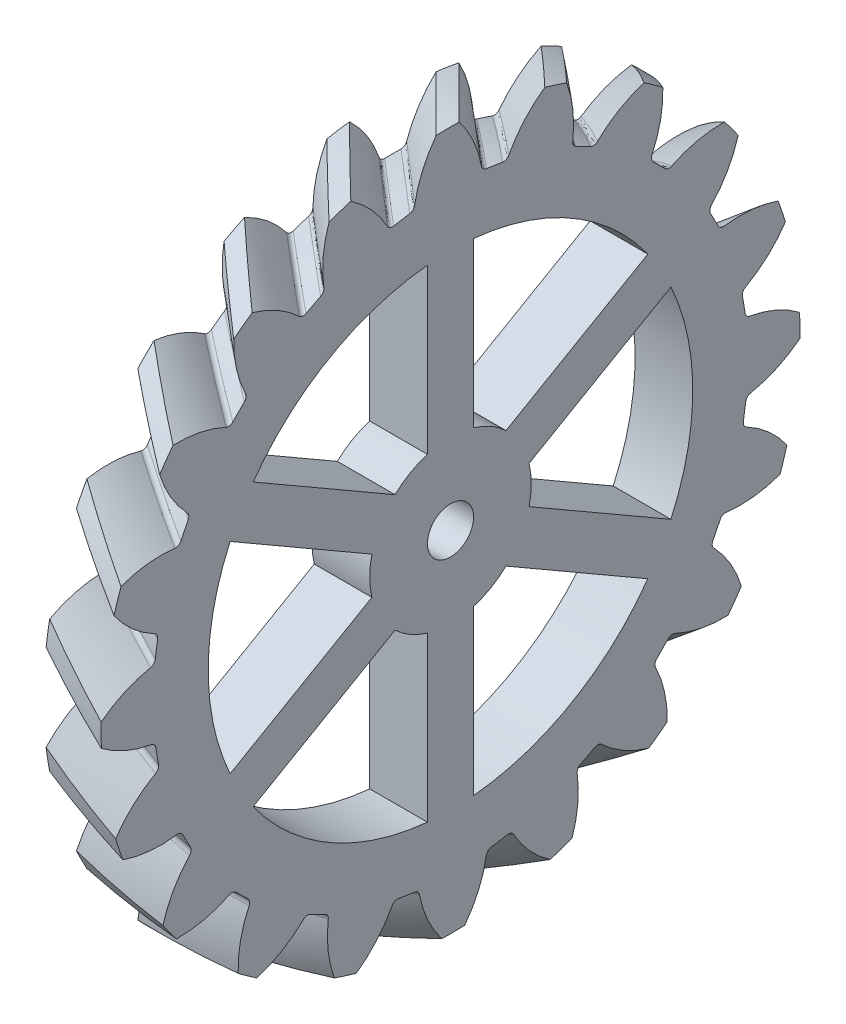
from build123d import *

# Parameters (mm, degrees)
BASPROSKE_W            = 5
BASPROSKE_H            = 30.284271247
TOOTHCUTRH_PITCH       = 190.281688141
TOOTHCUTRH_HEIGHT      = 5
TOOTHCUTRH_RADIUS      = 30.284271247
TOOTHCUTRH_START_ANGLE = -90
TEETHCUTSRH_COUNT      = 20
TEETHCUTSRH_ANGLE      = 342
BORSKE_R               = 2
BORE_DEPTH             = 62.5000025
CUT_EXTRUDE1_DEPTH     = 44.119301747


with BuildPart() as part:
    # BasProSke → Base-Revolve (revolve)
    with BuildSketch(Plane(origin=(0, 0, 0), x_dir=(1, 0, 0), z_dir=(0, 1, 0)), mode=Mode.PRIVATE) as base_revolve_sk:
        with Locations((2.5, 15.142135624)):
            Rectangle(BASPROSKE_W, BASPROSKE_H)
    revolve(base_revolve_sk.sketch.rotate(Axis((-10, 0, 0), (1, 0, 0)), 180), axis=Axis((-10, 0, 0), (1, 0, 0)))

    # ToothCutRH: sweep along a helix
    with BuildLine() as toothcutrh_path:
        add(Helix(TOOTHCUTRH_PITCH, TOOTHCUTRH_HEIGHT, TOOTHCUTRH_RADIUS, center=(0, 0, 0), direction=(1, 0, 0), mode=Mode.PRIVATE).rotate(Axis((0, 0, 0), (1, 0, 0)), TOOTHCUTRH_START_ANGLE))
    # TooCutSkeRH → ToothCutRH (sweep, cut)
    with BuildSketch(Plane(origin=(0, 0, 0), x_dir=(0, 0, -1), z_dir=(1, 0, 0))):
        with BuildLine():
            ThreePointArc((0.709729235, 25.774501512), (0, 25.784271247), (-0.709729235, 25.774501512))
            ThreePointArc((-0.709729235, 25.774501512), (-1.007455511, 25.862538868), (-1.196142332, 26.109092706))
            ThreePointArc((-1.196142332, 26.109092706), (-2.588726145, 28.736284217), (-4.692249269, 30.837858717))
            ThreePointArc((-4.692249269, 30.837858717), (0, 31.192799385), (4.692249269, 30.837858717))
            ThreePointArc((4.692249269, 30.837858717), (2.588726145, 28.736284217), (1.196142332, 26.109092706))
            ThreePointArc((1.196142332, 26.109092706), (1.007455511, 25.862538868), (0.709729235, 25.774501512))
        make_face()
    toothcutrh = sweep(path=toothcutrh_path.line, is_frenet=True, mode=Mode.SUBTRACT)

    # TeethCutsRH: ToothCutRH ×20 about axis
    teethcutsrh_axis = Axis((-10, 0, 0), (1, 0, 0))
    for i in range(1, TEETHCUTSRH_COUNT):
        add(toothcutrh.rotate(teethcutsrh_axis, i * TEETHCUTSRH_ANGLE / (TEETHCUTSRH_COUNT - 1)), mode=Mode.SUBTRACT)

    # BorSke → Bore (cut, symmetric)
    with BuildSketch(Plane(origin=(0, 0, 0), x_dir=(0, 0, -1), z_dir=(1, 0, 0))):
        with Locations(Location((0, 0, 0), (0, 0, 180))):
            Circle(BORSKE_R)
    extrude(amount=BORE_DEPTH, both=True, mode=Mode.SUBTRACT)

    # Sketch3 → Cut-Extrude1 (cut, through all)
    with BuildSketch(Plane(origin=(5, 0, 0), x_dir=(0, 0, -1), z_dir=(1, 0, 0))):
        with BuildLine():
            Line((-4.809475019, 5.086152774), (-17.10386699, 12.184323288))
            ThreePointArc((-17.10386699, 12.184323288), (-10.5, 18.186533479), (-2, 20.90454496))
            Line((-2, 20.90454496), (-2, 6.708203932))
            ThreePointArc((-2, 6.708203932), (-3.5, 6.062177826), (-4.809475019, 5.086152774))
        make_face()
        with BuildLine():
            Line((2, 6.708203932), (2, 20.90454496))
            ThreePointArc((2, 20.90454496), (10.5, 18.186533479), (17.10386699, 12.184323288))
            Line((17.10386699, 12.184323288), (4.809475019, 5.086152774))
            ThreePointArc((4.809475019, 5.086152774), (3.5, 6.062177826), (2, 6.708203932))
        make_face()
        with BuildLine():
            Line((6.809475019, 1.622051159), (19.10386699, 8.720221673))
            ThreePointArc((19.10386699, 8.720221673), (21, 0), (19.10386699, -8.720221673))
            Line((19.10386699, -8.720221673), (6.809475019, -1.622051159))
            ThreePointArc((6.809475019, -1.622051159), (7, 0), (6.809475019, 1.622051159))
        make_face()
        with BuildLine():
            Line((4.809475019, -5.086152774), (17.10386699, -12.184323288))
            ThreePointArc((17.10386699, -12.184323288), (10.5, -18.186533479), (2, -20.90454496))
            Line((2, -20.90454496), (2, -6.708203932))
            ThreePointArc((2, -6.708203932), (3.5, -6.062177826), (4.809475019, -5.086152774))
        make_face()
        with BuildLine():
            Line((-2, -6.708203932), (-2, -20.90454496))
            ThreePointArc((-2, -20.90454496), (-10.5, -18.186533479), (-17.10386699, -12.184323288))
            Line((-17.10386699, -12.184323288), (-4.809475019, -5.086152774))
            ThreePointArc((-4.809475019, -5.086152774), (-3.5, -6.062177826), (-2, -6.708203932))
        make_face()
        with BuildLine():
            Line((-6.809475019, -1.622051159), (-19.10386699, -8.720221673))
            ThreePointArc((-19.10386699, -8.720221673), (-21, 0), (-19.10386699, 8.720221673))
            Line((-19.10386699, 8.720221673), (-6.809475019, 1.622051159))
            ThreePointArc((-6.809475019, 1.622051159), (-7, 0), (-6.809475019, -1.622051159))
        make_face()
    extrude(amount=-CUT_EXTRUDE1_DEPTH, mode=Mode.SUBTRACT)


solid = part.part
